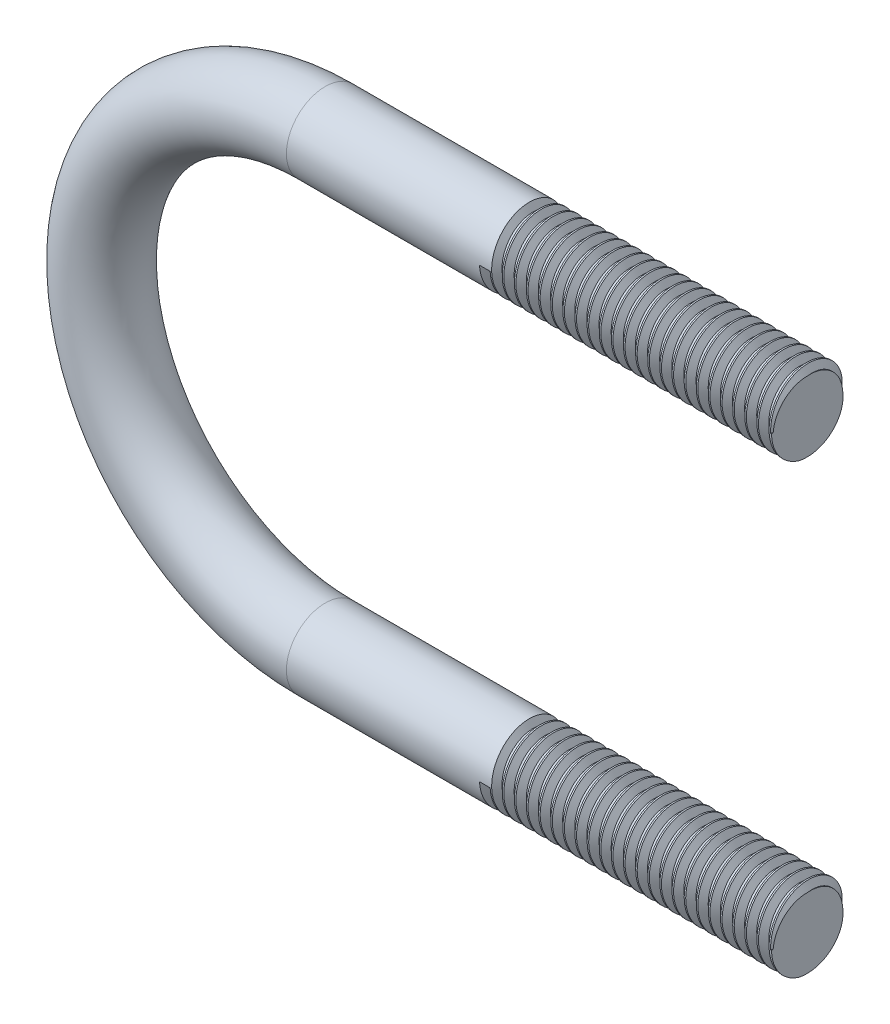
from build123d import *

# Parameters (mm, degrees)
ESBO_O4_R    = 4
ROSCA1_PITCH = 1.25
ROSCA2_PITCH = 1.25


with BuildPart() as part:
    # Varredura1: sweep along a path in Esboço2
    with BuildLine(Plane.XY) as varredura1_path:
        Line((50, 23.05), (0, 23.05))
        ThreePointArc((0, 23.05), (-23.05, 0), (0, -23.05))
        Line((0, -23.05), (50, -23.05))
    # Esboço4 → Varredura1 (sweep)
    with BuildSketch(Plane(origin=(50, 23.05, 0), x_dir=(0, 0, 1), z_dir=(-1, 0, 0))):
        Circle(ESBO_O4_R)
    sweep(path=varredura1_path.line)

    # Rosca1: the profile of Perfil da rosca1 profile screwed along a right-hand helix of 24 turns, 8 arcs to a turn; built about Z, then put on its axis
    rosca1_z = Axis((0, 0, 0), (0, 0, 1))
    rosca1_corners = [(4.0003, 0, -0.000173205), (4.0003, 0, 1.093923202), (3.323417656, 0, 0.703124998), (3.323417656, 0, 0.390624998)]
    with BuildLine(mode=Mode.PRIVATE) as rosca1_profile:
        Line(rosca1_corners[0], rosca1_corners[1])
        Line(rosca1_corners[1], rosca1_corners[2])
        Line(rosca1_corners[2], rosca1_corners[3])
        Line(rosca1_corners[3], rosca1_corners[0])
    rosca1_cap = Face(rosca1_profile.wire())
    rosca1_turn_angles = [0, 22.5, 45, 67.5, 90, 112.5, 135, 157.5, 180, 202.5, 225, 247.5, 270, 292.5, 315, 337.5, 360]
    rosca1_turn_weights = [1, 0.9238795325112867, 1, 0.9238795325112867, 1, 0.9238795325112867, 1, 0.9238795325112867, 1, 0.9238795325112867, 1, 0.9238795325112867, 1, 0.9238795325112867, 1, 0.9238795325112867, 1]
    rosca1_turn_rails = [Edge.make_bspline([Vector(p[0], p[1], 0).rotate(rosca1_z, rosca1_turn_angles[k]) / rosca1_turn_weights[k] + Vector(0, 0, p[2] + ROSCA1_PITCH * rosca1_turn_angles[k] / 360) for k in range(17)], [0, 0, 0, 1, 1, 2, 2, 3, 3, 4, 4, 5, 5, 6, 6, 7, 7, 8, 8, 8], 2, rosca1_turn_weights) for p in rosca1_corners]
    rosca1_turn_sides = [Face.make_surface_from_curves(rosca1_turn_rails[p[0]], rosca1_turn_rails[p[1]]) for p in [(0, 1), (1, 2), (2, 3), (3, 0)]]
    rosca1 = Plane(origin=(51, 23.05, 0), x_dir=(0, 0, 1), z_dir=(-1, 0, 0)) * Solid(Shell([*[p.moved(Location((0, 0, ROSCA1_PITCH * i))) for i in range(24) for p in rosca1_turn_sides], rosca1_cap, rosca1_cap.rotate(rosca1_z, 8640).moved(Location((0, 0, ROSCA1_PITCH * 8640 / 360)))]))
    add(rosca1, mode=Mode.SUBTRACT)

    # Rosca2: the profile of Perfil da rosca2 profile screwed along a right-hand helix of 24 turns, 8 arcs to a turn; built about Z, then put on its axis
    rosca2_z = Axis((0, 0, 0), (0, 0, 1))
    rosca2_corners = [(4.0003, 0, -0.000173205), (4.0003, 0, 1.093923202), (3.323417656, 0, 0.703124998), (3.323417656, 0, 0.390624998)]
    with BuildLine(mode=Mode.PRIVATE) as rosca2_profile:
        Line(rosca2_corners[0], rosca2_corners[1])
        Line(rosca2_corners[1], rosca2_corners[2])
        Line(rosca2_corners[2], rosca2_corners[3])
        Line(rosca2_corners[3], rosca2_corners[0])
    rosca2_cap = Face(rosca2_profile.wire())
    rosca2_turn_angles = [0, 22.5, 45, 67.5, 90, 112.5, 135, 157.5, 180, 202.5, 225, 247.5, 270, 292.5, 315, 337.5, 360]
    rosca2_turn_weights = [1, 0.9238795325112867, 1, 0.9238795325112867, 1, 0.9238795325112867, 1, 0.9238795325112867, 1, 0.9238795325112867, 1, 0.9238795325112867, 1, 0.9238795325112867, 1, 0.9238795325112867, 1]
    rosca2_turn_rails = [Edge.make_bspline([Vector(p[0], p[1], 0).rotate(rosca2_z, rosca2_turn_angles[k]) / rosca2_turn_weights[k] + Vector(0, 0, p[2] + ROSCA2_PITCH * rosca2_turn_angles[k] / 360) for k in range(17)], [0, 0, 0, 1, 1, 2, 2, 3, 3, 4, 4, 5, 5, 6, 6, 7, 7, 8, 8, 8], 2, rosca2_turn_weights) for p in rosca2_corners]
    rosca2_turn_sides = [Face.make_surface_from_curves(rosca2_turn_rails[p[0]], rosca2_turn_rails[p[1]]) for p in [(0, 1), (1, 2), (2, 3), (3, 0)]]
    rosca2 = Plane(origin=(51, -23.05, 0), x_dir=(0, 0, 1), z_dir=(-1, 0, 0)) * Solid(Shell([*[p.moved(Location((0, 0, ROSCA2_PITCH * i))) for i in range(24) for p in rosca2_turn_sides], rosca2_cap, rosca2_cap.rotate(rosca2_z, 8640).moved(Location((0, 0, ROSCA2_PITCH * 8640 / 360)))]))
    add(rosca2, mode=Mode.SUBTRACT)


solid = part.part
